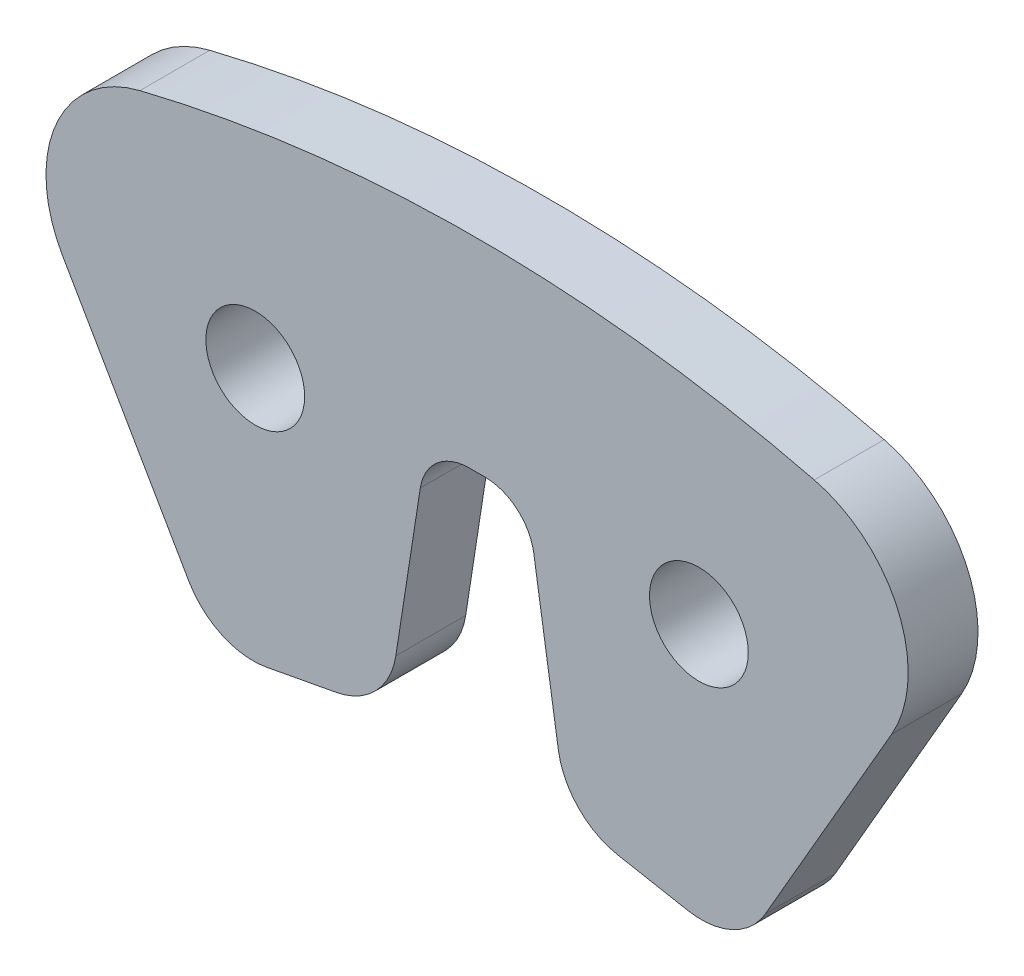
from build123d import *

# Parameters (mm, degrees)
SKETCH_2_R      = 1.06
EXTRUDE_1_DEPTH = 0.75
FILLET_1_R      = 2.65
FILLET_2_R      = 1.59
FILLET_3_R      = 1.06


with BuildPart() as part:
    # 草图2 → 拉伸1 (new, symmetric)
    with BuildSketch(Plane.XY):
        with BuildLine():
            Line((1.916731654, 20.523889322), (5.626784937, 19.830360168))
            Line((5.626784937, 19.830360168), (8.119880544, 24.148528428))
            Line((8.119880544, 24.148528428), (10.560448036, 28.375715323))
            ThreePointArc((10.560448036, 28.375715323), (0, 30.277124745), (-10.560448036, 28.375715323))
            Line((-10.560448036, 28.375715323), (-5.626784937, 19.830360168))
            Line((-5.626784937, 19.830360168), (-1.916731654, 20.523889322))
            Line((-1.916731654, 20.523889322), (-1.082856102, 25.895804953))
            ThreePointArc((-1.082856102, 25.895804953), (0, 25.91843536), (1.082856102, 25.895804953))
            Line((1.082856102, 25.895804953), (1.916731654, 20.523889322))
        make_face()
        with Locations((-4.7625, 25.477124745)):
            Circle(SKETCH_2_R, mode=Mode.SUBTRACT)
        with Locations((4.7625, 25.477124745)):
            Circle(SKETCH_2_R, mode=Mode.SUBTRACT)
    extrude(amount=EXTRUDE_1_DEPTH, both=True)

    # 圆角1
    fillet_1_edges = [part.edges().sort_by_distance(p)[0] for p in [
        (10.560448036, 28.375715323, 0),
        (-10.560448036, 28.375715323, 0),
    ]]
    fillet(fillet_1_edges, radius=FILLET_1_R)

    # 圆角2
    fillet_2_edges = [part.edges().sort_by_distance(p)[0] for p in [
        (5.626784937, 19.830360168, 0),
        (1.916731654, 20.523889322, 0),
        (-1.916731654, 20.523889322, 0),
        (-5.626784937, 19.830360168, 0),
    ]]
    fillet(fillet_2_edges, radius=FILLET_2_R)

    # 圆角3
    fillet_3_edges = [part.edges().sort_by_distance(p)[0] for p in [
        (1.082856102, 25.895804953, 0),
        (-1.082856102, 25.895804953, 0),
    ]]
    fillet(fillet_3_edges, radius=FILLET_3_R)


solid = part.part
